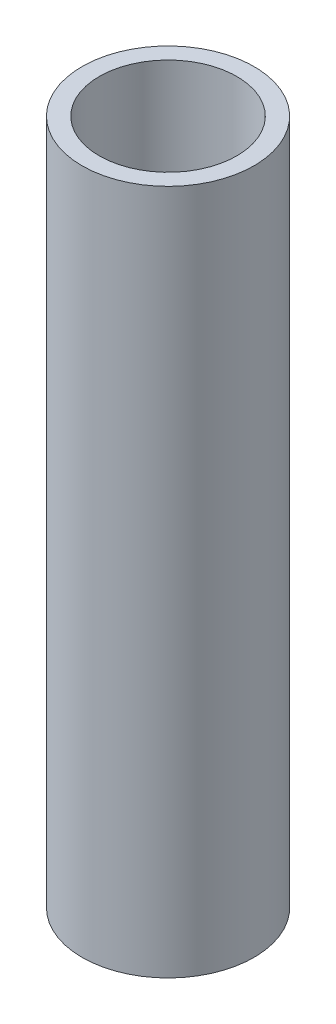
from build123d import *

# Parameters (mm, degrees)
CROQUIS1_R              = 5
CROQUIS1_R_2            = 4
SALIENTE_EXTRUIR1_DEPTH = 39.86


with BuildPart() as part:
    # Croquis1 → Saliente-Extruir1 (new body)
    with BuildSketch(Plane(origin=(0, 0, 0), x_dir=(1, 0, 0), z_dir=(0, 1, 0))):
        Circle(CROQUIS1_R)
        Circle(CROQUIS1_R_2, mode=Mode.SUBTRACT)
    extrude(amount=SALIENTE_EXTRUIR1_DEPTH)


solid = part.part
